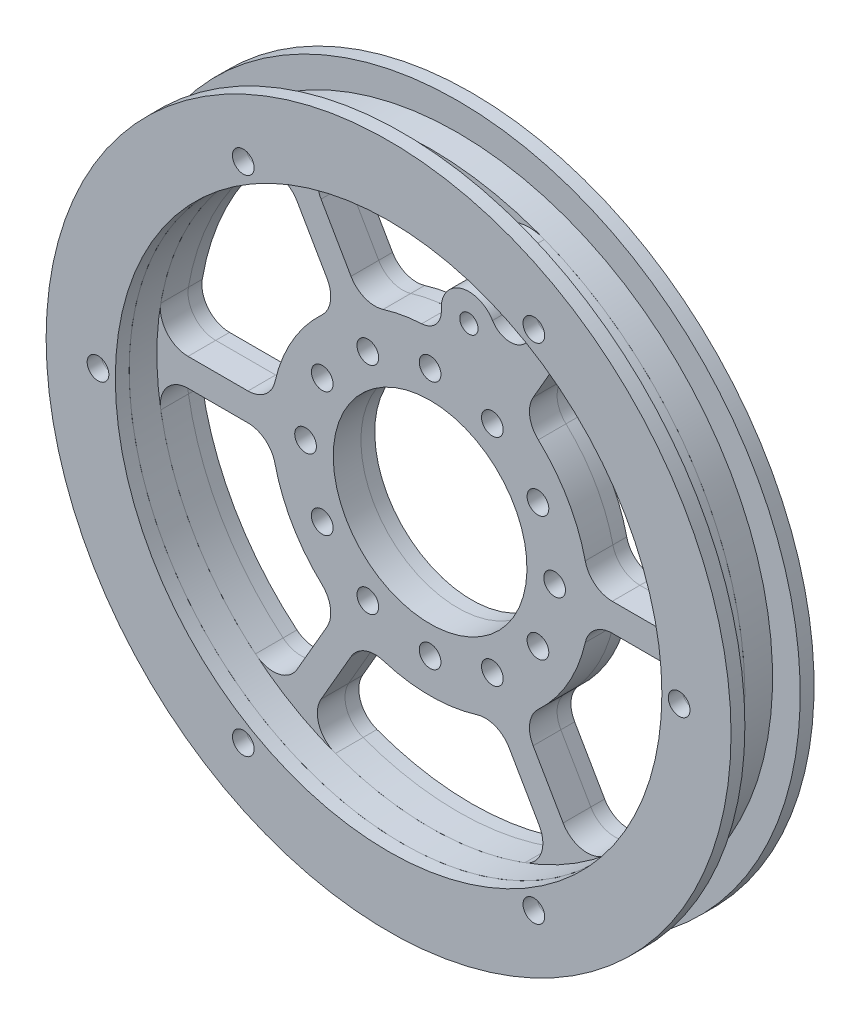
from build123d import *

# Parameters (mm, degrees)
SKETCH1_R                 = 2.4892
BOSS_EXTRUDE1_DEPTH       = 3.175
FILLET3_R                 = 1.5875
SKETCH2_R                 = 72.23125
SKETCH2_R_2               = 2.4892
SKETCH2_R_3               = 22.225
SKETCH2_R_4               = 2.1
BOSS_EXTRUDE2_DEPTH       = 6.35
SKETCH4_R                 = 78.58125
SKETCH4_R_2               = 2.4892
BOSS_EXTRUDE3_DEPTH       = 3.175
BOSS_EXTRUDE4_OUTLINE_R   = 78.58125
BOSS_EXTRUDE4_OUTLINE_R_2 = 2.4892
BOSS_EXTRUDE4_OUTLINE_R_3 = 22.225
BOSS_EXTRUDE4_DEPTH       = 3.175
FILLET4_R                 = 6.35
FILLET5_R                 = 6.35


# Read off the part's stored shape, not the designer's step: Boss-Extrude4
with BuildPart() as part:
    # Sketch1 → Boss-Extrude1 (new, symmetric)
    with BuildSketch(Plane.XY):
        with BuildLine():
            ThreePointArc((-62.62581867, -3.175), (-62.70625, 0), (-62.62581867, 3.175))
            ThreePointArc((-62.62581867, 3.175), (-54.305205476, 31.353125), (-34.062539992, 52.648049901))
            ThreePointArc((-34.062539992, 52.648049901), (-31.353125, 54.305205476), (-28.563278678, 55.823049901))
            ThreePointArc((-28.563278678, 55.823049901), (-21.28371557, 58.983703178), (-13.663241759, 61.199588346))
            ThreePointArc((-13.663241759, 61.199588346), (-18.617202125, 66.993781742), (-26.234383048, 67.298667317))
            ThreePointArc((-26.234383048, 67.298667317), (-40.75789001, -59.633445972), (72.23125, 0))
            ThreePointArc((72.23125, 0), (59.633445972, 40.75789001), (26.234383048, 67.298667317))
            ThreePointArc((26.234383048, 67.298667317), (18.617202125, 66.993781742), (13.663241759, 61.199588346))
            ThreePointArc((13.663241759, 61.199588346), (21.28371557, 58.983703178), (28.563278678, 55.823049901))
            ThreePointArc((28.563278678, 55.823049901), (31.353125, 54.305205476), (34.062539992, 52.648049901))
            ThreePointArc((34.062539992, 52.648049901), (54.305205476, 31.353125), (62.62581867, 3.175))
            ThreePointArc((62.62581867, 3.175), (62.70625, 0), (62.62581867, -3.175))
            ThreePointArc((62.62581867, -3.175), (54.305205476, -31.353125), (34.062539992, -52.648049901))
            ThreePointArc((34.062539992, -52.648049901), (31.353125, -54.305205476), (28.563278678, -55.823049901))
            ThreePointArc((28.563278678, -55.823049901), (0, -62.70625), (-28.563278678, -55.823049901))
            ThreePointArc((-28.563278678, -55.823049901), (-31.353125, -54.305205476), (-34.062539992, -52.648049901))
            ThreePointArc((-34.062539992, -52.648049901), (-54.305205476, -31.353125), (-62.62581867, -3.175))
        make_face()
        with Locations((-33.3375, -57.742243797)):
            Circle(SKETCH1_R, mode=Mode.SUBTRACT)
        with Locations((33.3375, -57.742243797)):
            Circle(SKETCH1_R, mode=Mode.SUBTRACT)
        with Locations((-66.675, 0)):
            Circle(SKETCH1_R, mode=Mode.SUBTRACT)
        with Locations((-33.3375, 57.742243797)):
            Circle(SKETCH1_R, mode=Mode.SUBTRACT)
        with Locations((66.675, 0)):
            Circle(SKETCH1_R, mode=Mode.SUBTRACT)
        with Locations((33.3375, 57.742243797)):
            Circle(SKETCH1_R, mode=Mode.SUBTRACT)
    extrude(amount=BOSS_EXTRUDE1_DEPTH, both=True)

    # Fillet3
    fillet3_edges = [part.edges().sort_by_distance(p)[0] for p in [
        (-13.663241759, 61.199588346, -1.5875),
        (13.663241759, 61.199588346, -1.5875),
    ]]
    fillet(fillet3_edges, radius=FILLET3_R)


with BuildPart() as body_2:
    # Sketch2 → Boss-Extrude2 (new body)
    with BuildSketch(Plane(origin=(0, 0, -3.175), x_dir=(-1, 0, 0), z_dir=(0, 0, -1))):
        with Locations(Location((0, 0, 0), (0, 0, 90))):
            Circle(SKETCH2_R)
        with BuildLine():
            ThreePointArc((-14.32768481, 45.240770263), (-18.450780614, 42.964850536), (-22.514183267, 45.345709309))
            Line((-22.514183267, 45.345709309), (-28.563278678, 55.823049901))
            ThreePointArc((-28.563278678, 55.823049901), (0, 62.70625), (28.563278678, 55.823049901))
            Line((28.563278678, 55.823049901), (15.437466632, 33.088476547))
            ThreePointArc((15.437466632, 33.088476547), (8.844501598, 35.425096298), (1.92694395, 36.461617398))
            ThreePointArc((1.92694395, 36.461617398), (-1.379790991, 38.051804417), (-2.574529526, 41.521068108))
            ThreePointArc((-2.574529526, 41.521068108), (-6.99559988, 47.979890407), (-14.32768481, 45.240770263))
        make_face(mode=Mode.SUBTRACT)
        with BuildLine():
            ThreePointArc((-20.936727946, 29.913476547), (-31.620752556, 18.25625), (-36.374194579, 3.175))
            Line((-36.374194579, 3.175), (-62.62581867, 3.175))
            ThreePointArc((-62.62581867, 3.175), (-54.305205476, 31.353125), (-34.062539992, 52.648049901))
            Line((-34.062539992, 52.648049901), (-20.936727946, 29.913476547))
        make_face(mode=Mode.SUBTRACT)
        with BuildLine():
            ThreePointArc((36.374194579, 3.175), (31.620752556, 18.25625), (20.936727946, 29.913476547))
            Line((20.936727946, 29.913476547), (34.062539992, 52.648049901))
            ThreePointArc((34.062539992, 52.648049901), (54.305205476, 31.353125), (62.62581867, 3.175))
            Line((62.62581867, 3.175), (36.374194579, 3.175))
        make_face(mode=Mode.SUBTRACT)
        with BuildLine():
            ThreePointArc((-36.374194579, -3.175), (-31.620752556, -18.25625), (-20.936727946, -29.913476547))
            Line((-20.936727946, -29.913476547), (-34.062539992, -52.648049901))
            ThreePointArc((-34.062539992, -52.648049901), (-54.305205476, -31.353125), (-62.62581867, -3.175))
            Line((-62.62581867, -3.175), (-36.374194579, -3.175))
        make_face(mode=Mode.SUBTRACT)
        with BuildLine():
            ThreePointArc((-15.437466632, -33.088476547), (0, -36.5125), (15.437466632, -33.088476547))
            Line((15.437466632, -33.088476547), (28.563278678, -55.823049901))
            ThreePointArc((28.563278678, -55.823049901), (0, -62.70625), (-28.563278678, -55.823049901))
            Line((-28.563278678, -55.823049901), (-15.437466632, -33.088476547))
        make_face(mode=Mode.SUBTRACT)
        with BuildLine():
            Line((36.374194579, -3.175), (62.62581867, -3.175))
            ThreePointArc((62.62581867, -3.175), (54.305205476, -31.353125), (34.062539992, -52.648049901))
            Line((34.062539992, -52.648049901), (20.936727946, -29.913476547))
            ThreePointArc((20.936727946, -29.913476547), (31.620752556, -18.25625), (36.374194579, -3.175))
        make_face(mode=Mode.SUBTRACT)
        with Locations(Location((-24.746675913, -14.2875, 0), (0, 0, 90))):
            Circle(SKETCH2_R_2, mode=Mode.SUBTRACT)
        with Locations(Location((-14.2875, -24.746675913, 0), (0, 0, 90))):
            Circle(SKETCH2_R_2, mode=Mode.SUBTRACT)
        with Locations(Location((0, -28.575, 0), (0, 0, 90))):
            Circle(SKETCH2_R_2, mode=Mode.SUBTRACT)
        with Locations(Location((-28.575, 0, 0), (0, 0, 90))):
            Circle(SKETCH2_R_2, mode=Mode.SUBTRACT)
        with Locations(Location((0, 0, 0), (0, 0, 90))):
            Circle(SKETCH2_R_3, mode=Mode.SUBTRACT)
        with Locations(Location((14.2875, -24.746675913, 0), (0, 0, 90))):
            Circle(SKETCH2_R_2, mode=Mode.SUBTRACT)
        with Locations(Location((24.746675913, -14.2875, 0), (0, 0, 90))):
            Circle(SKETCH2_R_2, mode=Mode.SUBTRACT)
        with Locations(Location((28.575, 0, 0), (0, 0, 90))):
            Circle(SKETCH2_R_2, mode=Mode.SUBTRACT)
        with Locations(Location((-24.746675913, 14.2875, 0), (0, 0, 90))):
            Circle(SKETCH2_R_2, mode=Mode.SUBTRACT)
        with Locations(Location((-14.2875, 24.746675913, 0), (0, 0, 90))):
            Circle(SKETCH2_R_2, mode=Mode.SUBTRACT)
        with Locations(Location((-8.911614848, 41.925851536, 0), (0, 0, 90))):
            Circle(SKETCH2_R_4, mode=Mode.SUBTRACT)
        with Locations(Location((14.2875, 24.746675913, 0), (0, 0, 90))):
            Circle(SKETCH2_R_2, mode=Mode.SUBTRACT)
        with Locations(Location((24.746675913, 14.2875, 0), (0, 0, 90))):
            Circle(SKETCH2_R_2, mode=Mode.SUBTRACT)
        with Locations(Location((0, 28.575, 0), (0, 0, 90))):
            Circle(SKETCH2_R_2, mode=Mode.SUBTRACT)
        with Locations(Location((-33.3375, -57.742243797, 0), (0, 0, 90))):
            Circle(SKETCH2_R_2, mode=Mode.SUBTRACT)
        with Locations(Location((-66.675, 0, 0), (0, 0, 90))):
            Circle(SKETCH2_R_2, mode=Mode.SUBTRACT)
        with Locations(Location((33.3375, -57.742243797, 0), (0, 0, 90))):
            Circle(SKETCH2_R_2, mode=Mode.SUBTRACT)
        with Locations(Location((66.675, 0, 0), (0, 0, 90))):
            Circle(SKETCH2_R_2, mode=Mode.SUBTRACT)
        with Locations(Location((-33.3375, 57.742243797, 0), (0, 0, 90))):
            Circle(SKETCH2_R_2, mode=Mode.SUBTRACT)
        with Locations(Location((33.3375, 57.742243797, 0), (0, 0, 90))):
            Circle(SKETCH2_R_2, mode=Mode.SUBTRACT)
    extrude(amount=BOSS_EXTRUDE2_DEPTH)

    # Fillet4
    fillet4_edges = [body_2.edges().sort_by_distance(p)[0] for p in [
        (36.374194579, 3.175, -6.35),
        (20.936727946, 29.913476547, -6.35),
        (34.062539992, 52.648049901, -6.35),
        (62.62581867, 3.175, -6.35),
        (20.936727946, -29.913476547, -6.35),
        (36.374194579, -3.175, -6.35),
        (62.62581867, -3.175, -6.35),
        (34.062539992, -52.648049901, -6.35),
        (-15.437466632, -33.088476547, -6.35),
        (15.437466632, -33.088476547, -6.35),
        (28.563278678, -55.823049901, -6.35),
        (-28.563278678, -55.823049901, -6.35),
        (-36.374194579, -3.175, -6.35),
        (-20.936727946, -29.913476547, -6.35),
        (-34.062539992, -52.648049901, -6.35),
        (-62.62581867, -3.175, -6.35),
        (-20.936727946, 29.913476547, -6.35),
        (-36.374194579, 3.175, -6.35),
        (-62.62581867, 3.175, -6.35),
        (-34.062539992, 52.648049901, -6.35),
        (-15.437466632, 33.088476547, -6.35),
        (-28.563278678, 55.823049901, -6.35),
        (28.563278678, 55.823049901, -6.35),
    ]]
    fillet(fillet4_edges, radius=FILLET4_R)


with BuildPart() as body_3:
    # Sketch4 → Boss-Extrude3 (new body)
    with BuildSketch(Plane.XY.offset(3.175)):
        Circle(SKETCH4_R)
        with Locations((-33.3375, -57.742243797)):
            Circle(SKETCH4_R_2, mode=Mode.SUBTRACT)
        with Locations((33.3375, -57.742243797)):
            Circle(SKETCH4_R_2, mode=Mode.SUBTRACT)
        with Locations((-66.675, 0)):
            Circle(SKETCH4_R_2, mode=Mode.SUBTRACT)
        with Locations((-33.3375, 57.742243797)):
            Circle(SKETCH4_R_2, mode=Mode.SUBTRACT)
        with BuildLine():
            ThreePointArc((-28.563278678, 55.823049901), (54.305205476, 31.353125), (34.062539992, -52.648049901))
            ThreePointArc((34.062539992, -52.648049901), (31.353125, -54.305205476), (28.563278678, -55.823049901))
            ThreePointArc((28.563278678, -55.823049901), (0, -62.70625), (-28.563278678, -55.823049901))
            ThreePointArc((-28.563278678, -55.823049901), (-31.353125, -54.305205476), (-34.062539992, -52.648049901))
            ThreePointArc((-34.062539992, -52.648049901), (-54.305205476, -31.353125), (-62.62581867, -3.175))
            ThreePointArc((-62.62581867, -3.175), (-62.70625, 0), (-62.62581867, 3.175))
            ThreePointArc((-62.62581867, 3.175), (-54.305205476, 31.353125), (-34.062539992, 52.648049901))
            ThreePointArc((-34.062539992, 52.648049901), (-31.353125, 54.305205476), (-28.563278678, 55.823049901))
        make_face(mode=Mode.SUBTRACT)
        with Locations((66.675, 0)):
            Circle(SKETCH4_R_2, mode=Mode.SUBTRACT)
        with Locations((33.3375, 57.742243797)):
            Circle(SKETCH4_R_2, mode=Mode.SUBTRACT)
    extrude(amount=BOSS_EXTRUDE3_DEPTH)


with BuildPart() as body_4:
    # Boss-Extrude4 outline → Boss-Extrude4 (new body)
    with BuildSketch(Plane(origin=(0, 0, -9.525), x_dir=(1, 0, 0), z_dir=(0, 0, -1))):
        Circle(BOSS_EXTRUDE4_OUTLINE_R)
        with Locations((-33.3375, -57.742243797)):
            Circle(BOSS_EXTRUDE4_OUTLINE_R_2, mode=Mode.SUBTRACT)
        with BuildLine():
            ThreePointArc((-36.374194579, -3.175), (-31.620752556, -18.25625), (-20.936727946, -29.913476547))
            Line((-20.936727946, -29.913476547), (-34.062539992, -52.648049901))
            ThreePointArc((-34.062539992, -52.648049901), (-54.305205476, -31.353125), (-62.62581867, -3.175))
            Line((-62.62581867, -3.175), (-36.374194579, -3.175))
        make_face(mode=Mode.SUBTRACT)
        with Locations((-14.2875, -24.746675913)):
            Circle(BOSS_EXTRUDE4_OUTLINE_R_2, mode=Mode.SUBTRACT)
        with Locations((-24.746675913, -14.2875)):
            Circle(BOSS_EXTRUDE4_OUTLINE_R_2, mode=Mode.SUBTRACT)
        with BuildLine():
            ThreePointArc((-15.437466632, -33.088476547), (0, -36.5125), (15.437466632, -33.088476547))
            Line((15.437466632, -33.088476547), (28.563278678, -55.823049901))
            ThreePointArc((28.563278678, -55.823049901), (0, -62.70625), (-28.563278678, -55.823049901))
            Line((-28.563278678, -55.823049901), (-15.437466632, -33.088476547))
        make_face(mode=Mode.SUBTRACT)
        with Locations((33.3375, -57.742243797)):
            Circle(BOSS_EXTRUDE4_OUTLINE_R_2, mode=Mode.SUBTRACT)
        with Locations((0, -28.575)):
            Circle(BOSS_EXTRUDE4_OUTLINE_R_2, mode=Mode.SUBTRACT)
        with Locations((14.2875, -24.746675913)):
            Circle(BOSS_EXTRUDE4_OUTLINE_R_2, mode=Mode.SUBTRACT)
        with Locations((24.746675913, -14.2875)):
            Circle(BOSS_EXTRUDE4_OUTLINE_R_2, mode=Mode.SUBTRACT)
        with BuildLine():
            ThreePointArc((20.936727946, -29.913476547), (31.620752556, -18.25625), (36.374194579, -3.175))
            Line((36.374194579, -3.175), (62.62581867, -3.175))
            ThreePointArc((62.62581867, -3.175), (54.305205476, -31.353125), (34.062539992, -52.648049901))
            Line((34.062539992, -52.648049901), (20.936727946, -29.913476547))
        make_face(mode=Mode.SUBTRACT)
        with Locations((-66.675, 0)):
            Circle(BOSS_EXTRUDE4_OUTLINE_R_2, mode=Mode.SUBTRACT)
        with BuildLine():
            ThreePointArc((-20.936727946, 29.913476547), (-31.620752556, 18.25625), (-36.374194579, 3.175))
            Line((-36.374194579, 3.175), (-62.62581867, 3.175))
            ThreePointArc((-62.62581867, 3.175), (-54.305205476, 31.353125), (-34.062539992, 52.648049901))
            Line((-34.062539992, 52.648049901), (-20.936727946, 29.913476547))
        make_face(mode=Mode.SUBTRACT)
        with Locations((-28.575, 0)):
            Circle(BOSS_EXTRUDE4_OUTLINE_R_2, mode=Mode.SUBTRACT)
        with Locations((-24.746675913, 14.2875)):
            Circle(BOSS_EXTRUDE4_OUTLINE_R_2, mode=Mode.SUBTRACT)
        with Locations((-14.2875, 24.746675913)):
            Circle(BOSS_EXTRUDE4_OUTLINE_R_2, mode=Mode.SUBTRACT)
        with Locations((-33.3375, 57.742243797)):
            Circle(BOSS_EXTRUDE4_OUTLINE_R_2, mode=Mode.SUBTRACT)
        Circle(BOSS_EXTRUDE4_OUTLINE_R_3, mode=Mode.SUBTRACT)
        with Locations((28.575, 0)):
            Circle(BOSS_EXTRUDE4_OUTLINE_R_2, mode=Mode.SUBTRACT)
        with Locations((24.746675913, 14.2875)):
            Circle(BOSS_EXTRUDE4_OUTLINE_R_2, mode=Mode.SUBTRACT)
        with Locations((0, 28.575)):
            Circle(BOSS_EXTRUDE4_OUTLINE_R_2, mode=Mode.SUBTRACT)
        with Locations((14.2875, 24.746675913)):
            Circle(BOSS_EXTRUDE4_OUTLINE_R_2, mode=Mode.SUBTRACT)
        with Locations((66.675, 0)):
            Circle(BOSS_EXTRUDE4_OUTLINE_R_2, mode=Mode.SUBTRACT)
        with BuildLine():
            ThreePointArc((36.374194579, 3.175), (31.620752556, 18.25625), (20.936727946, 29.913476547))
            Line((20.936727946, 29.913476547), (34.062539992, 52.648049901))
            ThreePointArc((34.062539992, 52.648049901), (54.305205476, 31.353125), (62.62581867, 3.175))
            Line((62.62581867, 3.175), (36.374194579, 3.175))
        make_face(mode=Mode.SUBTRACT)
        with BuildLine():
            ThreePointArc((15.437466632, 33.088476547), (0, 36.5125), (-15.437466632, 33.088476547))
            Line((-15.437466632, 33.088476547), (-28.563278678, 55.823049901))
            ThreePointArc((-28.563278678, 55.823049901), (0, 62.70625), (28.563278678, 55.823049901))
            Line((28.563278678, 55.823049901), (15.437466632, 33.088476547))
        make_face(mode=Mode.SUBTRACT)
        with Locations((33.3375, 57.742243797)):
            Circle(BOSS_EXTRUDE4_OUTLINE_R_2, mode=Mode.SUBTRACT)
    extrude(amount=BOSS_EXTRUDE4_DEPTH)

    # Fillet5
    fillet5_edges = [body_4.edges().sort_by_distance(p)[0] for p in [
        (-15.437466632, 33.088476547, -11.1125),
        (-28.563278678, 55.823049901, -11.1125),
        (28.563278678, 55.823049901, -11.1125),
        (15.437466632, 33.088476547, -11.1125),
        (-36.374194579, 3.175, -11.1125),
        (-62.62581867, 3.175, -11.1125),
        (-34.062539992, 52.648049901, -11.1125),
        (-20.936727946, 29.913476547, -11.1125),
        (-20.936727946, -29.913476547, -11.1125),
        (-34.062539992, -52.648049901, -11.1125),
        (-62.62581867, -3.175, -11.1125),
        (-36.374194579, -3.175, -11.1125),
        (15.437466632, -33.088476547, -11.1125),
        (28.563278678, -55.823049901, -11.1125),
        (-28.563278678, -55.823049901, -11.1125),
        (-15.437466632, -33.088476547, -11.1125),
        (36.374194579, -3.175, -11.1125),
        (62.62581867, -3.175, -11.1125),
        (34.062539992, -52.648049901, -11.1125),
        (20.936727946, -29.913476547, -11.1125),
        (20.936727946, 29.913476547, -11.1125),
        (34.062539992, 52.648049901, -11.1125),
        (62.62581867, 3.175, -11.1125),
        (36.374194579, 3.175, -11.1125),
    ]]
    fillet(fillet5_edges, radius=FILLET5_R)


solid = Compound([part.part, body_2.part, body_3.part, body_4.part])
